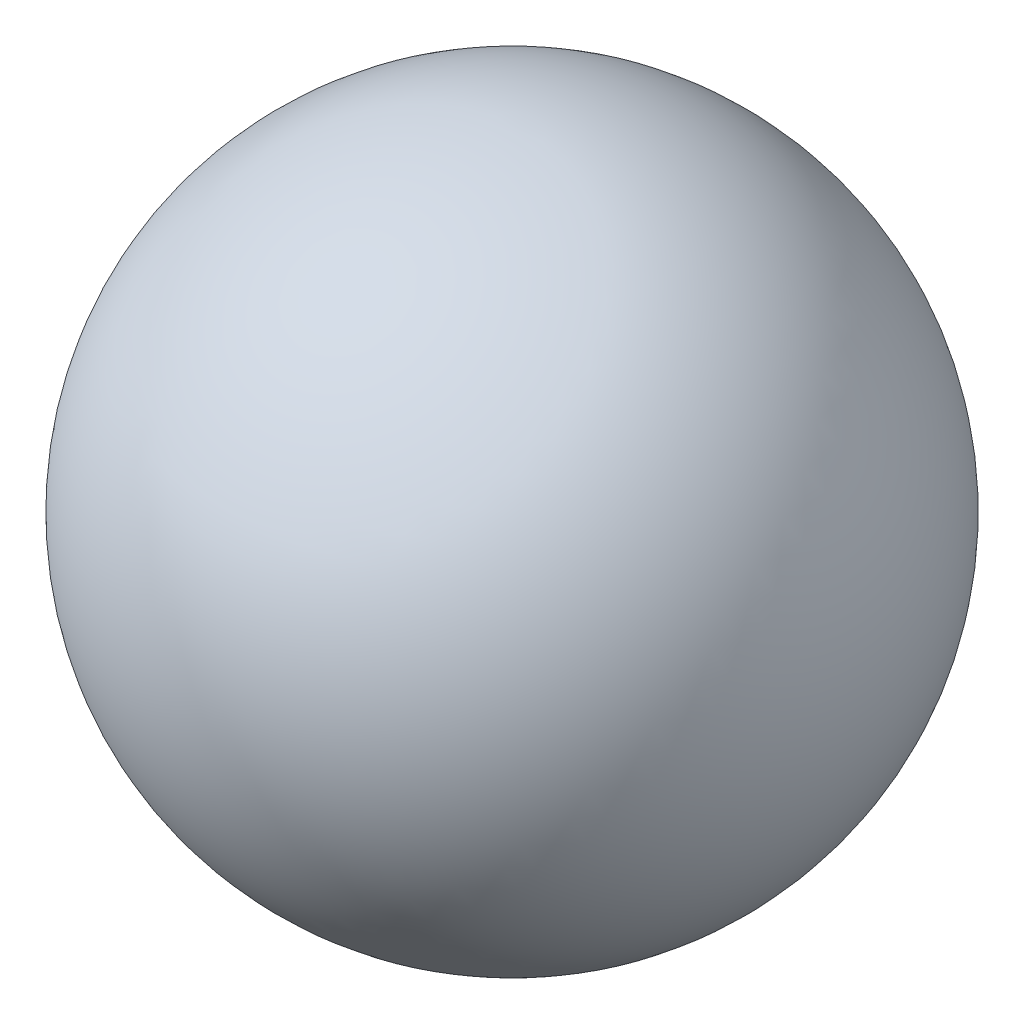
from build123d import *


with BuildPart() as part:
    # 草图1 → 旋转3 (revolve)
    with BuildSketch(Plane.XY):
        with BuildLine():
            Line((0, 50), (0, -50))
            ThreePointArc((0, -50), (50, 0), (0, 50))
        make_face()
    revolve(axis=Axis((0, 17.310975334, 0), (0, -1, 0)))


solid = part.part
